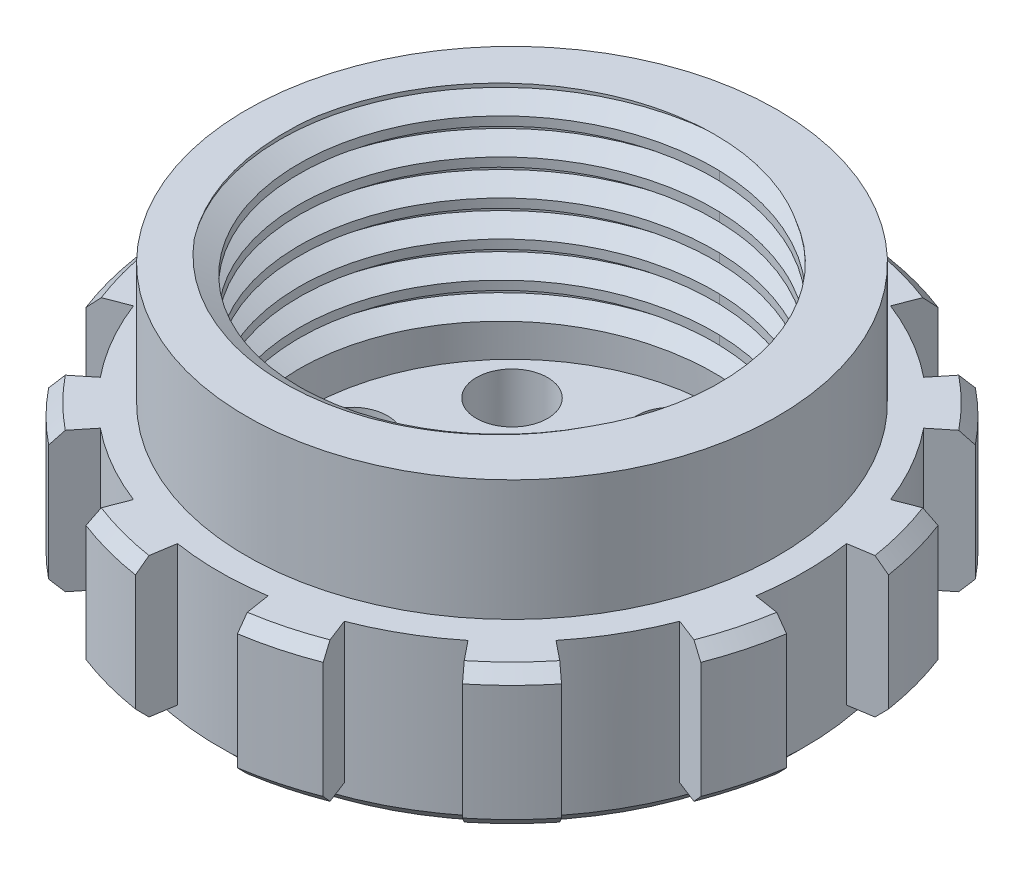
from build123d import *

# Parameters (mm, degrees)
SKETCH2_R          = 3.5
SKETCH2_R_2        = 1.5
CUT_EXTRUDE1_DEPTH = 10
CIRPATTERN1_COUNT  = 8
CHAMFER1_SIZE      = 0.5
CUT_EXTRUDE2_START = -10
CUT_EXTRUDE2_DEPTH = 10
CIRPATTERN2_COUNT  = 12
CUT_EXTRUDE3_START = -1
SKETCH4_R          = 13.9
SKETCH4_R_2        = 12.35
CUT_EXTRUDE3_DEPTH = 1
CHAMFER2_SIZE      = 0.5
THREAD1_PITCH      = 1.5


with BuildPart() as part:
    # Sketch1 → Revolve1 (revolve)
    with BuildSketch(Plane.XY, mode=Mode.PRIVATE) as revolve1_sk:
        Polygon((0, 0), (13.9, 0), (13.9, 6.9), (11.2, 6.9), (11.2, 12), (8.75, 12), (8.75, 2.3), (0, 2.3), align=None)
    revolve(revolve1_sk.sketch.rotate(Axis((0, 0, 0), (0, 1, 0)), 90), axis=Axis((0, 0, 0), (0, 1, 0)))

    # Sketch2 → Cut-Extrude1 (cut)
    with BuildSketch(Plane(origin=(0, 2.3, 0), x_dir=(1, 0, 0), z_dir=(0, 1, 0))):
        with Locations(Location((0, 0, 0), (0, 0, 270))):
            Circle(SKETCH2_R)
        with Locations(Location((6.75, 0, 0), (0, 0, 270))):
            Circle(SKETCH2_R_2)
    cut_extrude1 = extrude(amount=-CUT_EXTRUDE1_DEPTH, mode=Mode.SUBTRACT)

    # CirPattern1: Cut-Extrude1 ×8 about axis
    cirpattern1_axis = Axis((0, 0, 0), (0, 1, 0))
    for i in range(1, CIRPATTERN1_COUNT):
        add(cut_extrude1.rotate(cirpattern1_axis, i * 360 / CIRPATTERN1_COUNT), mode=Mode.SUBTRACT)

    # Chamfer1
    chamfer1_edges = [part.edges().sort_by_distance(p)[0] for p in [
        (0, 6.9, 13.9),
    ]]
    chamfer(chamfer1_edges, length=CHAMFER1_SIZE)

    # Sketch3 → Cut-Extrude2 (cut)
    with BuildSketch(Plane.XZ.offset(CUT_EXTRUDE2_START)):
        with BuildLine():
            Line((13.73271641, 2.15), (12.201370336, 1.910251799))
            ThreePointArc((12.201370336, 1.910251799), (12.35, 0), (12.201370336, -1.910251799))
            Line((12.201370336, -1.910251799), (13.73271641, -2.15))
            ThreePointArc((13.73271641, -2.15), (13.9, 0), (13.73271641, 2.15))
        make_face()
    cut_extrude2 = extrude(amount=CUT_EXTRUDE2_DEPTH, mode=Mode.SUBTRACT)

    # CirPattern2: Cut-Extrude2 ×12 about axis
    cirpattern2_axis = Axis((0, 0, 0), (0, 1, 0))
    for i in range(1, CIRPATTERN2_COUNT):
        add(cut_extrude2.rotate(cirpattern2_axis, i * 360 / CIRPATTERN2_COUNT), mode=Mode.SUBTRACT)

    # Sketch4 → Cut-Extrude3 (cut)
    with BuildSketch(Plane.XZ.offset(CUT_EXTRUDE3_START)):
        Circle(SKETCH4_R)
        with Locations(Location((0, 0, 0), (0, 0, 270))):
            Circle(SKETCH4_R_2, mode=Mode.SUBTRACT)
    extrude(amount=CUT_EXTRUDE3_DEPTH, mode=Mode.SUBTRACT)

    # Chamfer2
    chamfer2_edges = [part.edges().sort_by_distance(p)[0] for p in [
        (13.426368985, 1, 3.597584727),
        (13.426368985, 1, -3.597584727),
        (9.828784258, 1, 9.828784258),
        (9.828784258, 1, -9.828784258),
        (3.597584727, 1, -13.426368985),
        (-3.597584727, 1, -13.426368985),
        (-9.828784258, 1, -9.828784258),
        (-13.426368985, 1, -3.597584727),
        (-13.426368985, 1, 3.597584727),
        (-9.828784258, 1, 9.828784258),
        (-3.597584727, 1, 13.426368985),
        (3.597584727, 1, 13.426368985),
        (-0.958012619, 0, -12.312786517),
    ]]
    chamfer(chamfer2_edges, length=CHAMFER2_SIZE)

    # Thread1: the profile of Thread Profile1 profile screwed along a right-hand helix of 6.666667 turns, 8 arcs to a turn; built about Z, then put on its axis
    thread1_z = Axis((0, 0, 0), (0, 0, 1))
    thread1_corners = [(8.7497, 0, -0.000173205), (9.561898813, 0, 0.468749998), (9.561898813, 0, 0.656249998), (8.7497, 0, 1.125173201)]
    with BuildLine(mode=Mode.PRIVATE) as thread1_profile:
        Line(thread1_corners[0], thread1_corners[1])
        Line(thread1_corners[1], thread1_corners[2])
        Line(thread1_corners[2], thread1_corners[3])
        Line(thread1_corners[3], thread1_corners[0])
    thread1_cap = Face(thread1_profile.wire())
    thread1_turn_angles = [0, 22.5, 45, 67.5, 90, 112.5, 135, 157.5, 180, 202.5, 225, 247.5, 270, 292.5, 315, 337.5, 360]
    thread1_turn_weights = [1, 0.9238795325112867, 1, 0.9238795325112867, 1, 0.9238795325112867, 1, 0.9238795325112867, 1, 0.9238795325112867, 1, 0.9238795325112867, 1, 0.9238795325112867, 1, 0.9238795325112867, 1]
    thread1_turn_rails = [Edge.make_bspline([Vector(p[0], p[1], 0).rotate(thread1_z, thread1_turn_angles[k]) / thread1_turn_weights[k] + Vector(0, 0, p[2] + THREAD1_PITCH * thread1_turn_angles[k] / 360) for k in range(17)], [0, 0, 0, 1, 1, 2, 2, 3, 3, 4, 4, 5, 5, 6, 6, 7, 7, 8, 8, 8], 2, thread1_turn_weights) for p in thread1_corners]
    thread1_turn_sides = [Face.make_surface_from_curves(thread1_turn_rails[p[0]], thread1_turn_rails[p[1]]) for p in [(0, 1), (1, 2), (2, 3), (3, 0)]]
    thread1_last_angles = [2160, 2182.5, 2205, 2227.5, 2250, 2272.5, 2295, 2317.5, 2340, 2362.5, 2385, 2392.5, 2400]
    thread1_last_weights = [1, 0.9238795325112867, 1, 0.9238795325112867, 1, 0.9238795325112867, 1, 0.9238795325112867, 1, 0.9238795325112867, 1, 0.9914448613738109, 1]
    thread1_last_rails = [Edge.make_bspline([Vector(p[0], p[1], 0).rotate(thread1_z, thread1_last_angles[k]) / thread1_last_weights[k] + Vector(0, 0, p[2] + THREAD1_PITCH * thread1_last_angles[k] / 360) for k in range(13)], [0, 0, 0, 1, 1, 2, 2, 3, 3, 4, 4, 5, 5, 6, 6, 6], 2, thread1_last_weights) for p in thread1_corners]
    thread1_last_sides = [Face.make_surface_from_curves(thread1_last_rails[p[0]], thread1_last_rails[p[1]]) for p in [(0, 1), (1, 2), (2, 3), (3, 0)]]
    thread1 = Plane(origin=(0, 14, 0), x_dir=(-1, 0, 0), z_dir=(0, -1, 0)) * Solid(Shell([*[p.moved(Location((0, 0, THREAD1_PITCH * i))) for i in range(6) for p in thread1_turn_sides], *thread1_last_sides, thread1_cap, thread1_cap.rotate(thread1_z, 2400).moved(Location((0, 0, THREAD1_PITCH * 2400 / 360)))]))
    add(thread1, mode=Mode.SUBTRACT)


solid = part.part
